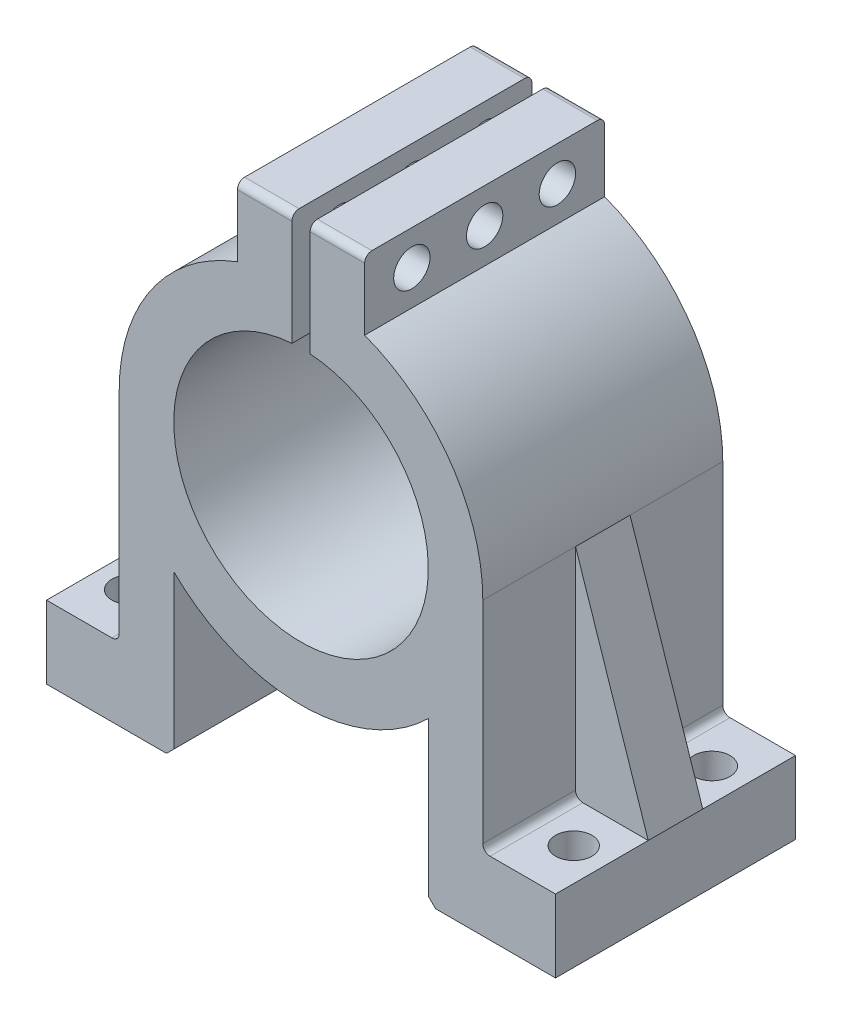
from build123d import *

# Parameters (mm, degrees)
BOSS_EXTRUDE1_DEPTH = 6.6
SKETCH3_R           = 1
CUT_EXTRUDE1_DEPTH  = 6.6
BOSS_EXTRUDE2_DEPTH = 6.6
CHAMFER1_SIZE       = 0.4
FILLET1_R           = 0.4
FILLET2_R           = 0.4
RIB17_START         = -1.5
RIB17_DEPTH         = 3
SKETCH25_R          = 1
CUT_EXTRUDE2_DEPTH  = 13.2


# Read off the part's stored shape, not the designer's step: Rib17
with BuildPart() as part:
    # Sketch1 → Boss-Extrude1 (new, symmetric)
    with BuildSketch(Plane.XY):
        with BuildLine():
            Line((-0.5, 13.2), (-3.5, 13.2))
            Line((-3.5, 13.2), (-3.5, 9.367496998))
            ThreePointArc((-3.5, 9.367496998), (0, -10), (3.5, 9.367496998))
            Line((3.5, 9.367496998), (3.5, 13.2))
            Line((3.5, 13.2), (0.5, 13.2))
            Line((0.5, 13.2), (0.5, 6.982120022))
            ThreePointArc((0.5, 6.982120022), (5.123475383, 4.769696007), (7, 0))
            ThreePointArc((7, 0), (-4.769696007, -5.123475383), (-0.5, 6.982120022))
            Line((-0.5, 6.982120022), (-0.5, 13.2))
        make_face()
    extrude(amount=BOSS_EXTRUDE1_DEPTH, both=True)

    # Sketch3 → Cut-Extrude1 (cut, symmetric)
    with BuildSketch(Plane(origin=(0, 0, 0), x_dir=(0, 0, -1), z_dir=(1, 0, 0))):
        with Locations(Location((0, 11.283748499, 0), (0, 0, 180))):
            Circle(SKETCH3_R)
        with Locations(Location((4.001379793, 11.283748499, 0), (0, 0, 180))):
            Circle(SKETCH3_R)
        with Locations(Location((-4.00303992, 11.283748499, 0), (0, 0, 180))):
            Circle(SKETCH3_R)
    extrude(amount=CUT_EXTRUDE1_DEPTH, both=True, mode=Mode.SUBTRACT)

    # Sketch4 → Boss-Extrude2 (add, symmetric)
    with BuildSketch(Plane.XY):
        with BuildLine():
            Line((-10, 0), (-10, -12))
            Line((-10, -12), (-14, -12))
            Line((-14, -12), (-14, -16))
            Line((-14, -16), (-7, -16))
            Line((-7, -16), (-7, -7.141428429))
            ThreePointArc((-7, -7.141428429), (-9.219544457, -3.872983346), (-10, 0))
        make_face()
        with BuildLine():
            Line((10, 0), (10, -12))
            Line((10, -12), (14, -12))
            Line((14, -12), (14, -16))
            Line((14, -16), (7, -16))
            Line((7, -16), (7, -7.141428429))
            ThreePointArc((7, -7.141428429), (9.219544457, -3.872983346), (10, 0))
        make_face()
    extrude(amount=BOSS_EXTRUDE2_DEPTH, both=True)

    # Chamfer1
    chamfer1_edges = [part.edges().sort_by_distance(p)[0] for p in [
        (-7, -16, 0),
        (7, -16, 0),
    ]]
    chamfer(chamfer1_edges, length=CHAMFER1_SIZE)

    # Fillet1
    fillet1_edges = [part.edges().sort_by_distance(p)[0] for p in [
        (-10, -12, 0),
        (10, -12, 0),
    ]]
    fillet(fillet1_edges, radius=FILLET1_R)

    # Fillet2
    fillet2_edges = [part.edges().sort_by_distance(p)[0] for p in [
        (2, 13.2, -6.6),
        (-2, 13.2, -6.6),
        (-2, 13.2, 6.6),
        (2, 13.2, 6.6),
    ]]
    fillet(fillet2_edges, radius=FILLET2_R)

    # Rib17 outline → Rib17 (add)
    with BuildSketch(Plane.XY.offset(RIB17_START)):
        with BuildLine():
            Line((14, -12), (10, 0))
            Line((10, 0), (10, -11.6))
            ThreePointArc((10, -11.6), (10.117157288, -11.882842712), (10.4, -12))
            Line((10.4, -12), (14, -12))
        make_face()
    rib17 = extrude(amount=RIB17_DEPTH)

    # Mirror1: Rib17 across plane
    add(rib17.mirror(Plane(origin=(0, 0, 0), x_dir=(0, 0, 1), z_dir=(1, 0, 0))))

    # Sketch25 → Cut-Extrude2 (cut)
    with BuildSketch(Plane(origin=(0, -12, 0), x_dir=(1, 0, 0), z_dir=(0, 1, 0))):
        with Locations(Location((-12.2, 3.8, 0), (0, 0, 270))):
            Circle(SKETCH25_R)
        with Locations(Location((-12.2, -3.8, 0), (0, 0, 270))):
            Circle(SKETCH25_R)
        with Locations(Location((12.2, 3.8, 0), (0, 0, 270))):
            Circle(SKETCH25_R)
        with Locations(Location((12.2, -3.8, 0), (0, 0, 270))):
            Circle(SKETCH25_R)
    extrude(amount=-CUT_EXTRUDE2_DEPTH, mode=Mode.SUBTRACT)


solid = part.part
